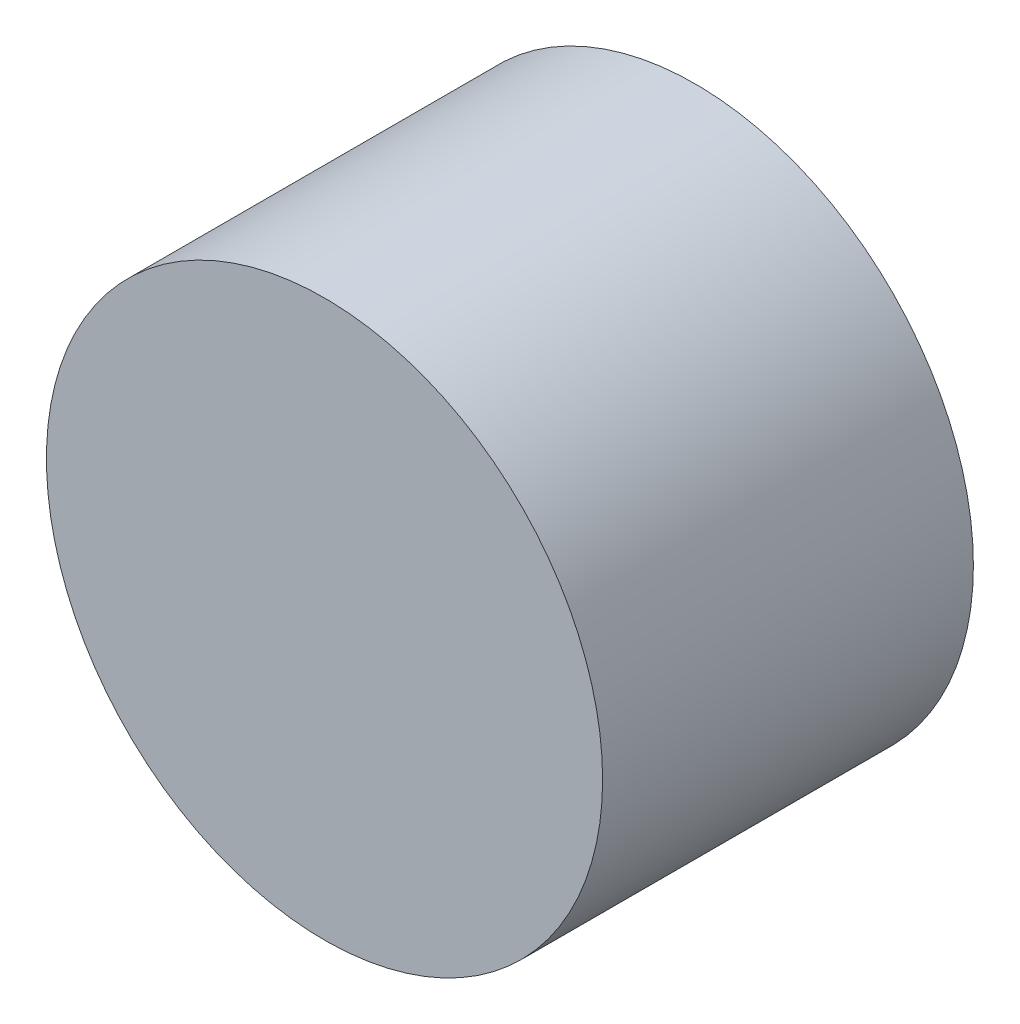
from build123d import *

# Parameters (mm, degrees)
SKETCH_1_R      = 18
EXTRUDE_1_DEPTH = 12


with BuildPart() as part:
    # 草图1 → 凸台-拉伸1 (new, symmetric)
    with BuildSketch(Plane.XY):
        Circle(SKETCH_1_R)
    extrude(amount=EXTRUDE_1_DEPTH, both=True)


solid = part.part
